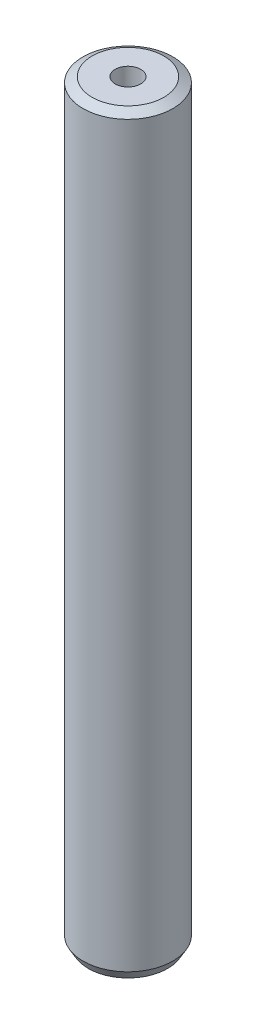
from build123d import *
from OCP.BRepFilletAPI import BRepFilletAPI_MakeChamfer

# Parameters (mm, degrees)
SKETCH1_R           = 5
BOSS_EXTRUDE1_DEPTH = 83.784723549
SKETCH2_R           = 1.419826
CUT_EXTRUDE1_DEPTH  = 85.082577864
CHAMFER1_SIZE       = 0.582004095
CHAMFER1_SIZE2      = 1.008060662


with BuildPart() as part:
    # Sketch1 → Boss-Extrude1 (new body)
    with BuildSketch(Plane(origin=(0, 0, 0), x_dir=(1, 0, 0), z_dir=(0, 1, 0))):
        Circle(SKETCH1_R)
    extrude(amount=BOSS_EXTRUDE1_DEPTH)

    # Sketch2 → Cut-Extrude1 (cut, through all)
    with BuildSketch(Plane(origin=(0, 0, 0), x_dir=(1, 0, 0), z_dir=(0, 1, 0))):
        Circle(SKETCH2_R)
    extrude(amount=CUT_EXTRUDE1_DEPTH, mode=Mode.SUBTRACT)

    # Chamfer1: one chamfer whose edges measure the first distance from different faces: ONE call of the kernel's chamfer builder (chamfer() names one face for all edges)
    chamfer1_edges_1 = [part.edges().sort_by_distance(p)[0] for p in [
        (-5, 83.784723549, 0),
    ]]
    chamfer1_side_1 = [part.faces().sort_by_distance(p)[0] for p in [
        (-5, 41.892361775, 0),
    ]]
    chamfer1_edges_2 = [part.edges().sort_by_distance(p)[0] for p in [
        (-5, 0, 0),
    ]]
    chamfer1_side_2 = [part.faces().sort_by_distance(p)[0] for p in [
        (-4.858578644, 0, 0),
    ]]
    chamfer1 = BRepFilletAPI_MakeChamfer(part.part.solid().wrapped)
    for e in chamfer1_edges_1:
        chamfer1.Add(CHAMFER1_SIZE, CHAMFER1_SIZE2, e.wrapped, chamfer1_side_1[0].wrapped)  # the first distance lies on this face
    for e in chamfer1_edges_2:
        chamfer1.Add(CHAMFER1_SIZE, CHAMFER1_SIZE2, e.wrapped, chamfer1_side_2[0].wrapped)  # the first distance lies on this face
    add(Compound.cast(chamfer1.Shape()), mode=Mode.REPLACE)


solid = part.part
